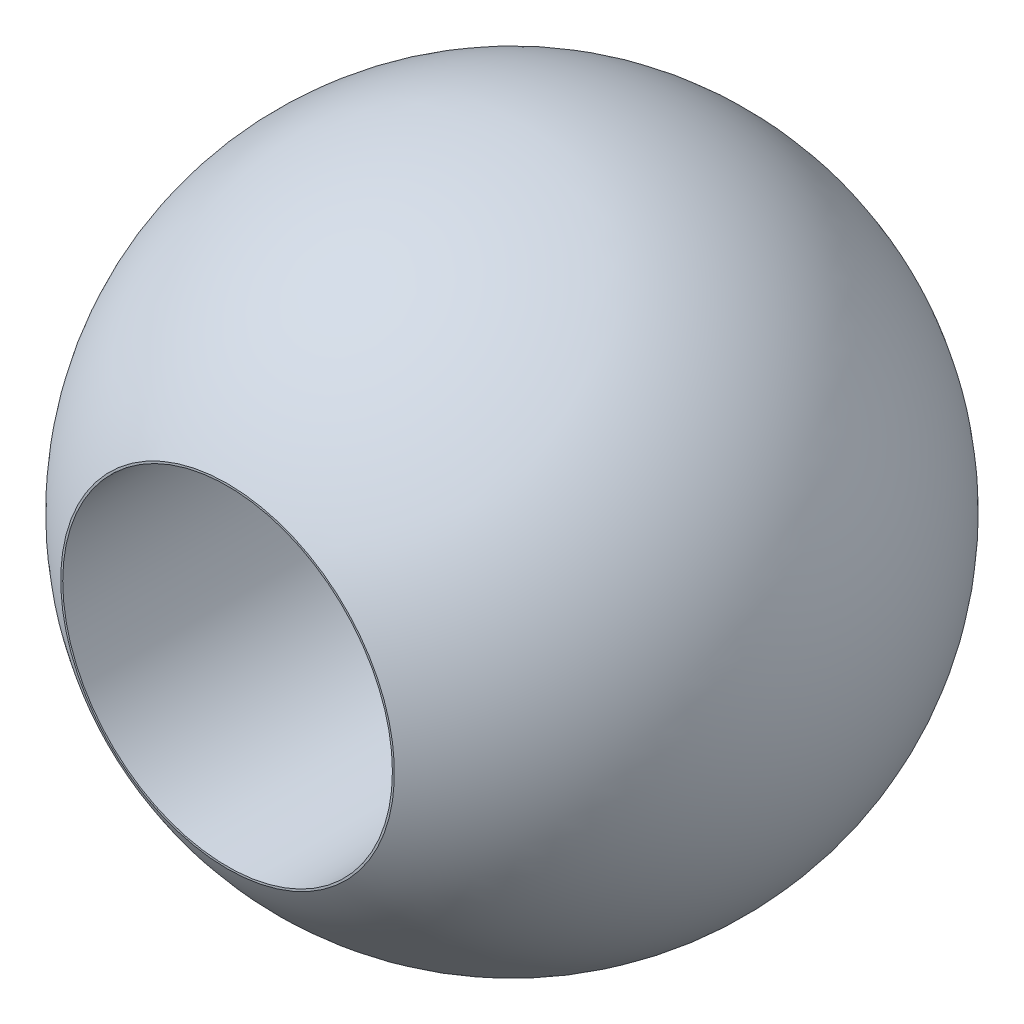
from build123d import *

# Parameters (mm, degrees)
SKETCH1_W               = 2
SKETCH1_H               = 14
CHAMFER2_SIZE           = 0.7
CUT_SWEEP1_PITCH        = 0.7
CUT_EXTRUDE1_DEPTH      = 19.241436347
CUT_EXTRUDE1_DEPTH_BACK = 19.241436347
CUT_EXTRUDE2_DEPTH      = 18.53745992
CUT_EXTRUDE2_DEPTH_BACK = 18.53745992
SKETCH6_R               = 4.04
CUT_EXTRUDE3_DEPTH      = 18.846568298
CUT_EXTRUDE3_DEPTH_BACK = 18.846568298
SKETCH8_W               = 2.05
SKETCH8_H               = 16.5
CUT_EXTRUDE4_DEPTH      = 18.846568298
CUT_EXTRUDE4_DEPTH_BACK = 18.846568298
SKETCH10_R              = 2
CUT_EXTRUDE5_DEPTH      = 18.846568298
CUT_EXTRUDE5_DEPTH_BACK = 18.846568298
SKETCH14_W              = 11
SKETCH14_H              = 0.1


with BuildPart() as part:
    # Sketch1 → Revolve1 (revolve)
    with BuildSketch(Plane.XY, mode=Mode.PRIVATE) as revolve1_sk:
        with Locations((1, -7)):
            Rectangle(SKETCH1_W, SKETCH1_H)
    revolve(revolve1_sk.sketch.rotate(Axis((0, 16.5, 0), (0, -1, 0)), 180), axis=Axis((0, 16.5, 0), (0, -1, 0)))

    # Chamfer2
    chamfer2_edges = [part.edges().sort_by_distance(p)[0] for p in [
        (2, -14, 0),
    ]]
    chamfer(chamfer2_edges, length=CHAMFER2_SIZE)

    # Cut-Sweep1: the profile of Sketch13 profile screwed along a right-hand helix of 21 turns, 6 arcs to a turn; built about Z, then put on its axis
    cut_sweep1_z = Axis((0, 0, 0), (0, 0, 1))
    cut_sweep1_corners = [(2.0003, 0, -0.612673205), (2.0003, 0, 0.000173205), (1.545336663, 0, -0.2625), (1.545336663, 0, -0.35)]
    with BuildLine(mode=Mode.PRIVATE) as cut_sweep1_profile:
        Line(cut_sweep1_corners[0], cut_sweep1_corners[1])
        Line(cut_sweep1_corners[1], cut_sweep1_corners[2])
        Line(cut_sweep1_corners[2], cut_sweep1_corners[3])
        Line(cut_sweep1_corners[3], cut_sweep1_corners[0])
    cut_sweep1_cap = Face(cut_sweep1_profile.wire())
    cut_sweep1_turn_angles = [0, 30, 60, 90, 120, 150, 180, 210, 240, 270, 300, 330, 360]
    cut_sweep1_turn_weights = [1, 0.8660254037844387, 1, 0.8660254037844387, 1, 0.8660254037844387, 1, 0.8660254037844387, 1, 0.8660254037844387, 1, 0.8660254037844387, 1]
    cut_sweep1_turn_rails = [Edge.make_bspline([Vector(p[0], p[1], 0).rotate(cut_sweep1_z, cut_sweep1_turn_angles[k]) / cut_sweep1_turn_weights[k] + Vector(0, 0, p[2] + CUT_SWEEP1_PITCH * cut_sweep1_turn_angles[k] / 360) for k in range(13)], [0, 0, 0, 1, 1, 2, 2, 3, 3, 4, 4, 5, 5, 6, 6, 6], 2, cut_sweep1_turn_weights) for p in cut_sweep1_corners]
    cut_sweep1_turn_sides = [Face.make_surface_from_curves(cut_sweep1_turn_rails[p[0]], cut_sweep1_turn_rails[p[1]]) for p in [(0, 1), (1, 2), (2, 3), (3, 0)]]
    cut_sweep1 = Plane(origin=(0, -14, 0), x_dir=(0, 0, 1), z_dir=(0, 1, 0)) * Solid(Shell([*[p.moved(Location((0, 0, CUT_SWEEP1_PITCH * i))) for i in range(21) for p in cut_sweep1_turn_sides], cut_sweep1_cap, cut_sweep1_cap.rotate(cut_sweep1_z, 7560).moved(Location((0, 0, CUT_SWEEP1_PITCH * 7560 / 360)))]))
    add(cut_sweep1, mode=Mode.SUBTRACT)

    # Sketch4 → Revolve2 (revolve)
    with BuildSketch(Plane.XY, mode=Mode.PRIVATE) as revolve2_sk:
        with BuildLine():
            Line((2, 0), (0, 0))
            Line((0, 0), (0, 16.5))
            ThreePointArc((0, 16.5), (4.885197037, 13.526826054), (4.488742964, 7.821763602))
            ThreePointArc((4.488742964, 7.821763602), (2.637183192, 4.104078075), (2, 0))
        make_face()
    revolve(revolve2_sk.sketch.rotate(Axis((0, 16.5, 0), (0, 1, 0)), 180), axis=Axis((0, 16.5, 0), (0, 1, 0)))

    # Sketch5 → Cut-Extrude1 (cut, two sides: drawn at the far end of the back side and taken through both)
    with BuildSketch(Plane(origin=(0, 0, 0), x_dir=(0, 0, -1), z_dir=(1, 0, 0)).offset(-CUT_EXTRUDE1_DEPTH_BACK)):
        Polygon((2.25, 16.5), (5.5, 16.5), (5.5, 0), (2, 0), (2.25, 0.9), align=None)
        Polygon((-2.25, 16.5), (-2.25, 0.9), (-2, 0), (-5.5, 0), (-5.5, 16.5), align=None)
    extrude(amount=CUT_EXTRUDE1_DEPTH + CUT_EXTRUDE1_DEPTH_BACK, mode=Mode.SUBTRACT)

    # Sketch6 → Cut-Extrude2 (cut, two sides: drawn at the far end of the back side and taken through both)
    with BuildSketch(Plane.XY.offset(-CUT_EXTRUDE2_DEPTH_BACK)):
        with Locations((0, 11)):
            Circle(SKETCH6_R)
    extrude(amount=CUT_EXTRUDE2_DEPTH + CUT_EXTRUDE2_DEPTH_BACK, mode=Mode.SUBTRACT)

    # Sketch14 → Cut-Extrude5 (cut, two sides: drawn at the far end of the back side and taken through both)
    with BuildSketch(Plane.XY.offset(-CUT_EXTRUDE5_DEPTH_BACK)):
        with Locations((0, 16.45)):
            Rectangle(SKETCH14_W, SKETCH14_H)
    extrude(amount=CUT_EXTRUDE5_DEPTH + CUT_EXTRUDE5_DEPTH_BACK, mode=Mode.SUBTRACT)


with BuildPart() as body_2:
    # Sketch7 → Revolve3 (revolve)
    with BuildSketch(Plane.XY):
        with BuildLine():
            Line((0, 15), (0, 7))
            ThreePointArc((0, 7), (4, 11), (0, 15))
        make_face()
    revolve(axis=Axis((0, 0, 0), (0, 1, 0)))

    # Sketch8 → Cut-Extrude3 (cut, two sides: drawn at the far end of the back side and taken through both)
    with BuildSketch(Plane(origin=(0, 0, 0), x_dir=(0, 0, -1), z_dir=(1, 0, 0)).offset(-CUT_EXTRUDE3_DEPTH_BACK)):
        with Locations((-4.475, 8.25)):
            Rectangle(SKETCH8_W, SKETCH8_H)
        with Locations((4.475, 8.25)):
            Rectangle(SKETCH8_W, SKETCH8_H)
    extrude(amount=CUT_EXTRUDE3_DEPTH + CUT_EXTRUDE3_DEPTH_BACK, mode=Mode.SUBTRACT)

    # Sketch10 → Cut-Extrude4 (cut, two sides: drawn at the far end of the back side and taken through both)
    with BuildSketch(Plane.XY.offset(-CUT_EXTRUDE4_DEPTH_BACK)):
        with Locations((0, 11)):
            Circle(SKETCH10_R)
    extrude(amount=CUT_EXTRUDE4_DEPTH + CUT_EXTRUDE4_DEPTH_BACK, mode=Mode.SUBTRACT)


solid = body_2.part
